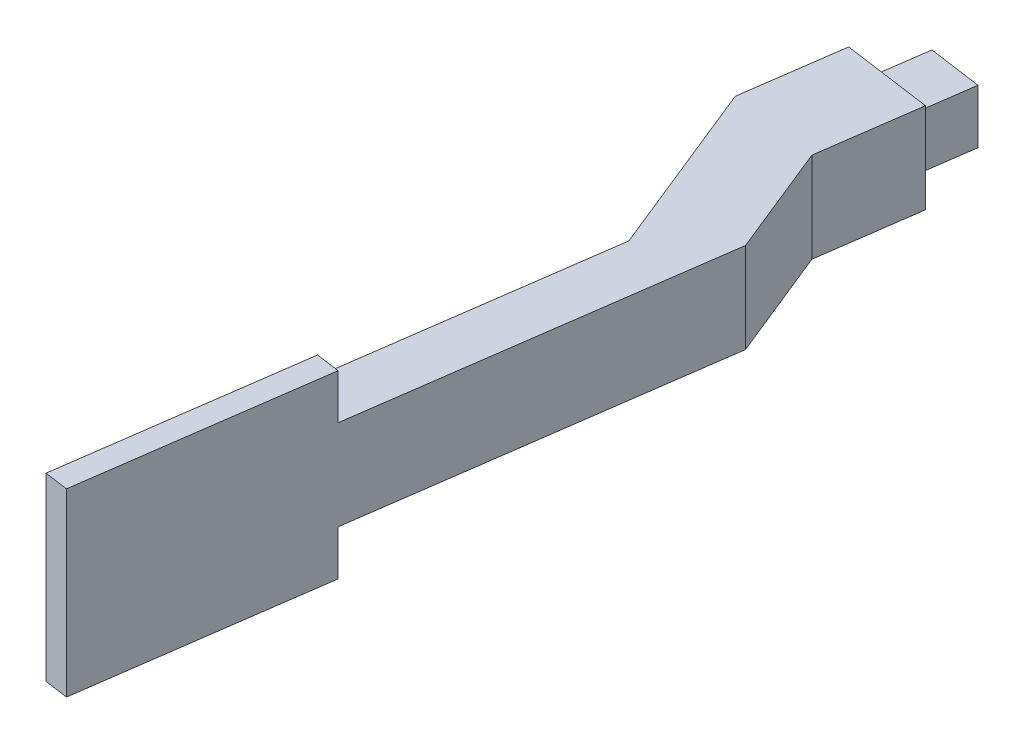
from build123d import *

# Parameters (mm, degrees)
ESQUISSE2_R                  = 20
BOSS_EXTRU_1_DEPTH           = 5
BOSS_EXTRU_2_DEPTH           = 5
R_P_TITION_CIRCULAIRE1_COUNT = 24
D_GAGEMENT_M22_D             = 5.1
BOSS_EXTRU_3_DEPTH           = 7.5
ENL_V_MAT_EXTRU_2_DEPTH      = 83.82071633
ENL_V_MAT_EXTRU_2_DEPTH_BACK = 83.82071633
ESQUISSE13_W                 = 57.206213055
ESQUISSE13_H                 = 37.798612504
ESQUISSE14_W                 = 4.5
ESQUISSE14_H                 = 4.5
BOSS_EXTRU_5_DEPTH           = 5
ESQUISSE17_W                 = 20
ESQUISSE17_H                 = 15
BOSS_EXTRU_7_DEPTH           = 2
CONG_1_R                     = 2
CONG_2_R                     = 2


with BuildPart() as part:
    # Esquisse2 → Boss.-Extru.1 (new body)
    with BuildSketch(Plane(origin=(0, 0, 0), x_dir=(1, 0, 0), z_dir=(0, 1, 0))):
        with Locations(Location((0, 0, 0), (0, 0, 270))):
            Circle(ESQUISSE2_R)
    extrude(amount=BOSS_EXTRU_1_DEPTH)

    # Esquisse3 → Boss.-Extru.2 (add)
    with BuildSketch(Plane(origin=(0, 5, 0), x_dir=(1, 0, 0), z_dir=(0, 1, 0))):
        Polygon((-1.625, 19.933875062), (-1.25, 21.933875062), (1.25, 21.933875062), (1.625, 19.933875062), align=None)
    boss_extru_2 = extrude(amount=-BOSS_EXTRU_2_DEPTH)

    # Répétition circulaire1: Boss.-Extru.2 ×24 about axis
    r_p_tition_circulaire1_axis = Axis((0, 0, 0), (0, 1, 0))
    for i in range(1, R_P_TITION_CIRCULAIRE1_COUNT):
        add(boss_extru_2.rotate(r_p_tition_circulaire1_axis, i * 360 / R_P_TITION_CIRCULAIRE1_COUNT))

    # Dégagement M22 (through all)
    with Locations(Plane(origin=(0, 5, 0), x_dir=(1, 0, 0), z_dir=(0, 1, 0))):
        with Locations((0, 0)):
            Hole(D_GAGEMENT_M22_D / 2)

    # Esquisse11 → Boss.-Extru.3 (add)
    with BuildSketch(Plane(origin=(0, 5, 0), x_dir=(1, 0, 0), z_dir=(0, 1, 0))):
        Polygon((-5.801101772, -14.332121903), (1.625908743, -15.37592016), (-0.461687771, -30.229941191), (3.284378163, -39.501779737), (-2.282545875, -79.112502486), (-6.738752185, -78.486223532), (-1.894992792, -44.021084607), (-7.888698287, -29.186142934), align=None)
    extrude(amount=-BOSS_EXTRU_3_DEPTH)

    # Esquisse13 → Enlèv. mat.-Extru.2 (cut, two sides: drawn at the far end of the back side and taken through both)
    with BuildSketch(Plane(origin=(3.713505258, 0, 0.521899129), x_dir=(0.13917310096006574, 0, -0.9902680687415703), z_dir=(0.9902680687415703, 0, 0.13917310096006574)).offset(-ENL_V_MAT_EXTRU_2_DEPTH_BACK)):
        with Locations((6.964953995, 7.661661133)):
            Rectangle(ESQUISSE13_W, ESQUISSE13_H)
    extrude(amount=ENL_V_MAT_EXTRU_2_DEPTH + ENL_V_MAT_EXTRU_2_DEPTH_BACK, mode=Mode.SUBTRACT)

    # Esquisse14 → Boss.-Extru.5 (add)
    with BuildSketch(Plane(origin=(-3.011448787, 0, 21.427571519), x_dir=(-0.9902680687415703, 0, -0.13917310096006574), z_dir=(0.13917310096006574, 0, -0.9902680687415703))):
        with Locations((0, 1.25)):
            Rectangle(ESQUISSE14_W, ESQUISSE14_H)
    extrude(amount=BOSS_EXTRU_5_DEPTH)

    # Esquisse17 → Boss.-Extru.7 (add)
    with BuildSketch(Plane(origin=(8.664845601, 0, 1.217764633), x_dir=(0.13917310096006535, 0, -0.9902680687415704), z_dir=(0.9902680687415704, 0, 0.13917310096006535))):
        with Locations((-78.660254038, 1.25)):
            Rectangle(ESQUISSE17_W, ESQUISSE17_H)
    extrude(amount=-BOSS_EXTRU_7_DEPTH)

    # Congé1
    cong_1_edges = [part.edges().sort_by_distance(p)[0] for p in [
        (-3.567216508, -2.5, 73.882815941),
        (-3.567216508, 5, 73.882815941),
        (-4.263082013, 1.25, 78.834156284),
    ]]
    fillet(cong_1_edges, radius=CONG_1_R)

    # Congé2
    # the kernel refuses this fillet: 2 mm, written as the material it takes off along each edge
    with BuildSketch(Plane(origin=(-6.738752185, 9.270248109, 78.486223532), x_dir=(0.13917310096006505, 0, -0.9902680687415704), z_dir=(0, -1, 0))) as cong_2_piece_1:
        with BuildLine():
            CenterArc((1.708099244, 2), CONG_2_R, 202.024312837, 67.975687163)
            Line((-0.145950378, 1.25), (-0.33135534, 1.175))
            ThreePointArc((-0.33135534, 1.175), (-0.2, 0.5), (-0.2, 0))
            Line((-0.2, 0), (0, -0.2))
            Line((0, -0.2), (1.708099244, -0.2))
            Line((1.708099244, -0.2), (1.708099244, 0))
        make_face()
    extrude(amount=16.040496218, mode=Mode.SUBTRACT)


solid = part.part
